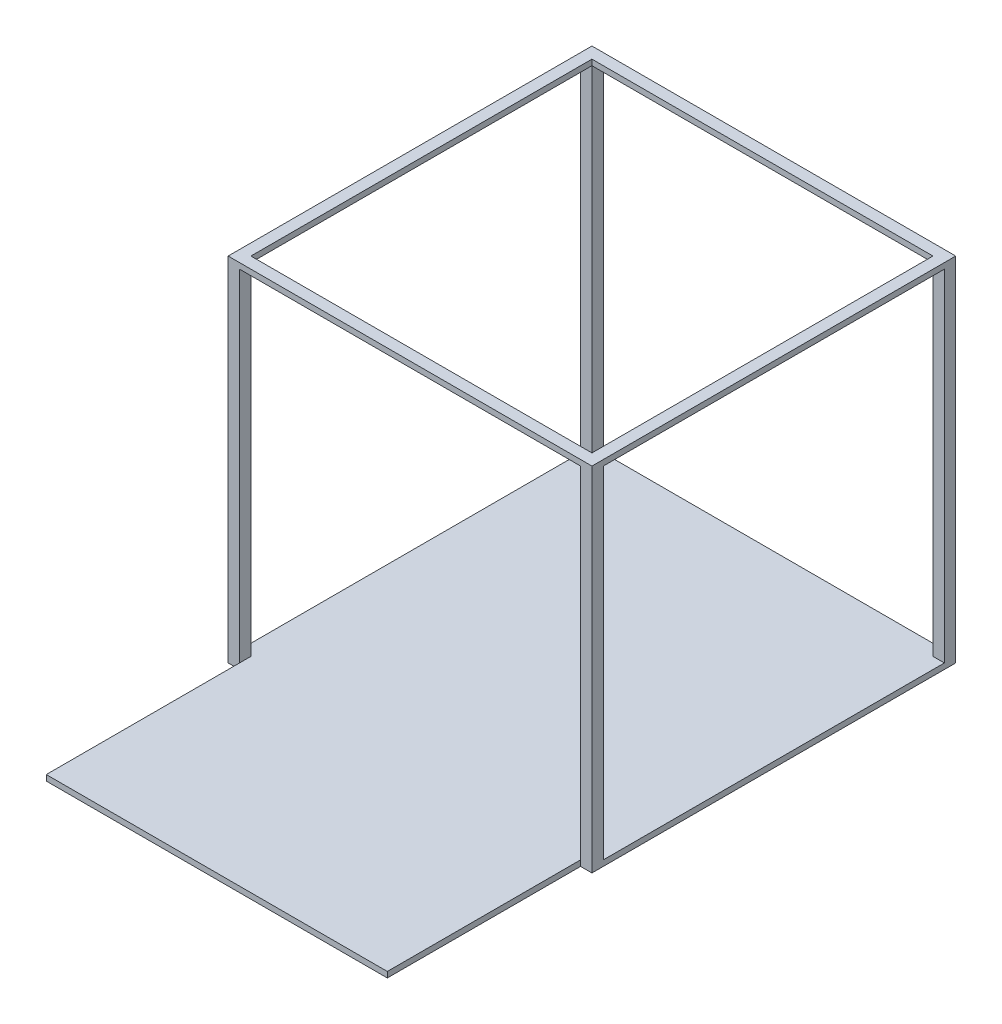
from build123d import *

# Parameters (mm, degrees)
SKETCH1_W           = 406.4
SKETCH1_H           = 406.4
BOSS_EXTRUDE1_DEPTH = 6.35
SKETCH2_W           = 12.7
SKETCH2_H           = 12.7
BOSS_EXTRUDE2_DEPTH = 381
SKETCH3_W           = 406.4
SKETCH3_H           = 406.4
SKETCH3_W_2         = 381
SKETCH3_H_2         = 381
BOSS_EXTRUDE3_DEPTH = 6.35
SKETCH4_W           = 381
SKETCH4_H           = 228.6
BOSS_EXTRUDE4_DEPTH = 6.35


with BuildPart() as part:
    # Sketch1 → Boss-Extrude1 (new body)
    with BuildSketch(Plane(origin=(0, 0, 0), x_dir=(1, 0, 0), z_dir=(0, 1, 0))):
        Rectangle(SKETCH1_W, SKETCH1_H)
    extrude(amount=BOSS_EXTRUDE1_DEPTH)

    # Sketch2 → Boss-Extrude2 (add)
    with BuildSketch(Plane(origin=(0, 6.35, 0), x_dir=(1, 0, 0), z_dir=(0, 1, 0))):
        with Locations((-196.85, 196.85)):
            Rectangle(SKETCH2_W, SKETCH2_H)
        with Locations((196.85, 196.85)):
            Rectangle(SKETCH2_W, SKETCH2_H)
        with Locations((196.85, -196.85)):
            Rectangle(SKETCH2_W, SKETCH2_H)
        with Locations((-196.85, -196.85)):
            Rectangle(SKETCH2_W, SKETCH2_H)
    extrude(amount=BOSS_EXTRUDE2_DEPTH)

    # Sketch3 → Boss-Extrude3 (add)
    with BuildSketch(Plane(origin=(0, 387.35, 0), x_dir=(1, 0, 0), z_dir=(0, 1, 0))):
        Rectangle(SKETCH3_W, SKETCH3_H)
        Rectangle(SKETCH3_W_2, SKETCH3_H_2, mode=Mode.SUBTRACT)
    extrude(amount=BOSS_EXTRUDE3_DEPTH)

    # Sketch4 → Boss-Extrude4 (add)
    with BuildSketch(Plane(origin=(0, 6.35, 0), x_dir=(1, 0, 0), z_dir=(0, 1, 0))):
        with Locations((0, -304.8)):
            Rectangle(SKETCH4_W, SKETCH4_H)
    extrude(amount=-BOSS_EXTRUDE4_DEPTH)


solid = part.part
